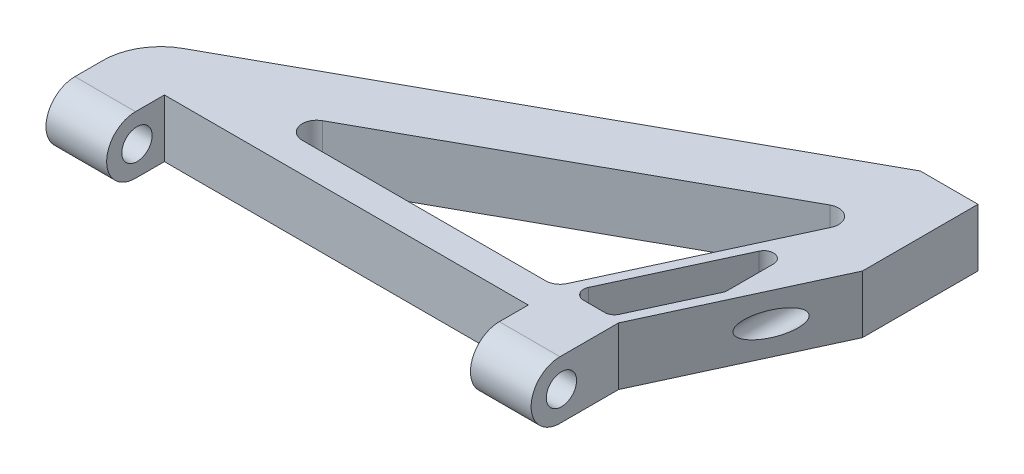
from build123d import *
from build123d.topology import SkipClean

# Parameters (mm, degrees)
BOSS_EXTRUDE1_DEPTH = 19.05
CUT_EXTRUDE1_REACH  = 216.504
SKETCH3_R           = 3.96875
FILLET1_RADIUS      = 9.525
FILLET1_LENGTH      = 20
SKETCH6_R           = 5
CUT_EXTRUDE3_DEPTH  = 203.106166408
FILLET2_RADIUS      = 9.525
FILLET2_LENGTH      = 20
FILLET6_R           = 19.05
THREAD2_PITCH       = 1.058333333
CUT_EXTRUDE5_DEPTH  = 15.875


with BuildPart() as part:
    # Sketch1 → Boss-Extrude1 (new body)
    with BuildSketch(Plane(origin=(0, 0, 0), x_dir=(1, 0, 0), z_dir=(0, 1, 0))):
        Polygon((156.35, 0), (175.4, 0), (175.4, -38.1), (150, -93.164947205), (150, -122), (130, -122), (130, -102.95), (10, -102.95), (10, -122), (-10, -122), (-10, -92), align=None)
        with BuildLine():
            Line((157.786628611, -30.803615949), (130.297657595, -90.39726704))
            ThreePointArc((130.297657595, -90.39726704), (128.540269513, -92.413789606), (125.97306512, -93.164947205))
            Line((125.97306512, -93.164947205), (45.707646364, -93.164947205))
            ThreePointArc((45.707646364, -93.164947205), (41.096269587, -89.592661671), (43.402752991, -84.234849242))
            Line((43.402752991, -84.234849242), (151.157142762, -24.641198151))
            ThreePointArc((151.157142762, -24.641198151), (156.704511177, -25.320564205), (157.786628611, -30.803615949))
        make_face(mode=Mode.SUBTRACT)
    extrude(amount=BOSS_EXTRUDE1_DEPTH)

    # Cut-Extrude1: up to this plane
    cut_extrude1_end = Plane(origin=(159.118387118, 19.05, 73.397092668), z_dir=(-0.9080509134554, 0, -0.41885980777918247))
    # Sketch3 → Cut-Extrude1 (cut, up to the surface)
    with BuildSketch(Plane(origin=(0, 0, 0), x_dir=(-1, 0, 0), z_dir=(0, 0, -1)), mode=Mode.PRIVATE) as cut_extrude1_sk1:
        with Locations((-165.875, 9.525)):
            Circle(SKETCH3_R)
    cut_extrude1_tool1 = split(extrude(cut_extrude1_sk1.sketch, amount=-CUT_EXTRUDE1_REACH, mode=Mode.PRIVATE), bisect_by=cut_extrude1_end, keep=Keep.BOTH, mode=Mode.PRIVATE)
    add(cut_extrude1_tool1.solids().sort_by_distance((165.875, 9.525, 0))[0], mode=Mode.SUBTRACT)

    # Fillet1: full round fillet: the end face becomes a half cylinder, R = half its width
    fillet1_face = Plane((0, 9.525, 122), x_dir=(-1, 0, 0), z_dir=(0, 0, 1))  # on the end face: x along it, z out of the body
    fillet1_slab = fillet1_face.offset(-FILLET1_RADIUS / 2) * Box(FILLET1_LENGTH, 2 * FILLET1_RADIUS, FILLET1_RADIUS, mode=Mode.PRIVATE)  # the body's end, R deep
    fillet1_round = Plane((0, 9.525, 112.475), x_dir=(0, 0, 1), z_dir=(-1, 0, 0)) * Cylinder(FILLET1_RADIUS, FILLET1_LENGTH, mode=Mode.PRIVATE)  # its axis R under the face
    add(fillet1_slab - fillet1_round, mode=Mode.SUBTRACT)

    # Sketch6 → Cut-Extrude3 (cut, through all)
    with BuildSketch(Plane(origin=(150, 0, 0), x_dir=(0, 0, -1), z_dir=(1, 0, 0))):
        with Locations((-112, 9.525)):
            Circle(SKETCH6_R)
    extrude(amount=-CUT_EXTRUDE3_DEPTH, mode=Mode.SUBTRACT)

    # Fillet2: full round fillet: the end face becomes a half cylinder, R = half its width
    fillet2_face = Plane((140, 9.525, 122), x_dir=(1, 0, 0), z_dir=(0, 0, 1))  # on the end face: x along it, z out of the body
    fillet2_slab = fillet2_face.offset(-FILLET2_RADIUS / 2) * Box(FILLET2_LENGTH, 2 * FILLET2_RADIUS, FILLET2_RADIUS, mode=Mode.PRIVATE)  # the body's end, R deep
    fillet2_round = Plane((140, 9.525, 112.475), x_dir=(0, 0, 1), z_dir=(1, 0, 0)) * Cylinder(FILLET2_RADIUS, FILLET2_LENGTH, mode=Mode.PRIVATE)  # its axis R under the face
    add(fillet2_slab - fillet2_round, mode=Mode.SUBTRACT)

    # Fillet6
    fillet6_edges = [part.edges().sort_by_distance(p)[0] for p in [
        (-10, 9.525, 92),
    ]]
    fillet(fillet6_edges, radius=FILLET6_R)

    # Thread2: the profile of Thread Profile2 profile screwed along a right-hand helix of 27 turns, 8 arcs to a turn; built about Z, then put on its axis
    with SkipClean():  # the faces are left unmerged after this step: merging them gives an invalid solid
        thread2_z = Axis((0, 0, 0), (0, 0, 1))
        thread2_corners = [(3.96845, 0, -0.000173205), (4.541589718, 0, 0.330729165), (4.541589718, 0, 0.463020832), (3.96845, 0, 0.793923202)]
        with BuildLine(mode=Mode.PRIVATE) as thread2_profile:
            Line(thread2_corners[0], thread2_corners[1])
            Line(thread2_corners[1], thread2_corners[2])
            Line(thread2_corners[2], thread2_corners[3])
            Line(thread2_corners[3], thread2_corners[0])
        thread2_cap = Face(thread2_profile.wire())
        thread2_turn_angles = [0, 22.5, 45, 67.5, 90, 112.5, 135, 157.5, 180, 202.5, 225, 247.5, 270, 292.5, 315, 337.5, 360]
        thread2_turn_weights = [1, 0.9238795325112867, 1, 0.9238795325112867, 1, 0.9238795325112867, 1, 0.9238795325112867, 1, 0.9238795325112867, 1, 0.9238795325112867, 1, 0.9238795325112867, 1, 0.9238795325112867, 1]
        thread2_turn_rails = [Edge.make_bspline([Vector(p[0], p[1], 0).rotate(thread2_z, thread2_turn_angles[k]) / thread2_turn_weights[k] + Vector(0, 0, p[2] + THREAD2_PITCH * thread2_turn_angles[k] / 360) for k in range(17)], [0, 0, 0, 1, 1, 2, 2, 3, 3, 4, 4, 5, 5, 6, 6, 7, 7, 8, 8, 8], 2, thread2_turn_weights) for p in thread2_corners]
        thread2_turn_sides = [Face.make_surface_from_curves(thread2_turn_rails[p[0]], thread2_turn_rails[p[1]]) for p in [(0, 1), (1, 2), (2, 3), (3, 0)]]
        thread2 = Plane(origin=(165.875, 9.525, 0), x_dir=(1, 0, 0), z_dir=(0, 0, 1)) * Solid(Shell([*[p.moved(Location((0, 0, THREAD2_PITCH * i))) for i in range(27) for p in thread2_turn_sides], thread2_cap, thread2_cap.rotate(thread2_z, 9720).moved(Location((0, 0, THREAD2_PITCH * 9720 / 360)))]))
        add(thread2, mode=Mode.SUBTRACT)

    # Sketch11 → Cut-Extrude5 (cut)
    with SkipClean():  # the faces are left unmerged after this step: merging them gives an invalid solid
        with BuildSketch(Plane(origin=(0, 19.05, 0), x_dir=(1, 0, 0), z_dir=(0, 1, 0))):
            with BuildLine():
                Line((147.67610498, -90.622843655), (158.43931165, -67.289166212))
                ThreePointArc((158.43931165, -67.289166212), (158.657406699, -66.640059508), (158.73125, -65.959286322))
                Line((158.73125, -65.959286322), (158.73125, -50.799082641))
                ThreePointArc((158.73125, -50.799082641), (156.237023186, -47.697925942), (152.67318835, -49.469202751))
                Line((152.67318835, -49.469202751), (134.916981721, -87.963083875))
                ThreePointArc((134.916981721, -87.963083875), (135.125815104, -91.00443336), (137.800043372, -92.467963765))
                Line((137.800043372, -92.467963765), (144.79304333, -92.467963765))
                ThreePointArc((144.79304333, -92.467963765), (146.504512925, -91.967192032), (147.67610498, -90.622843655))
            make_face()
        extrude(amount=-CUT_EXTRUDE5_DEPTH, mode=Mode.SUBTRACT)


solid = part.part
